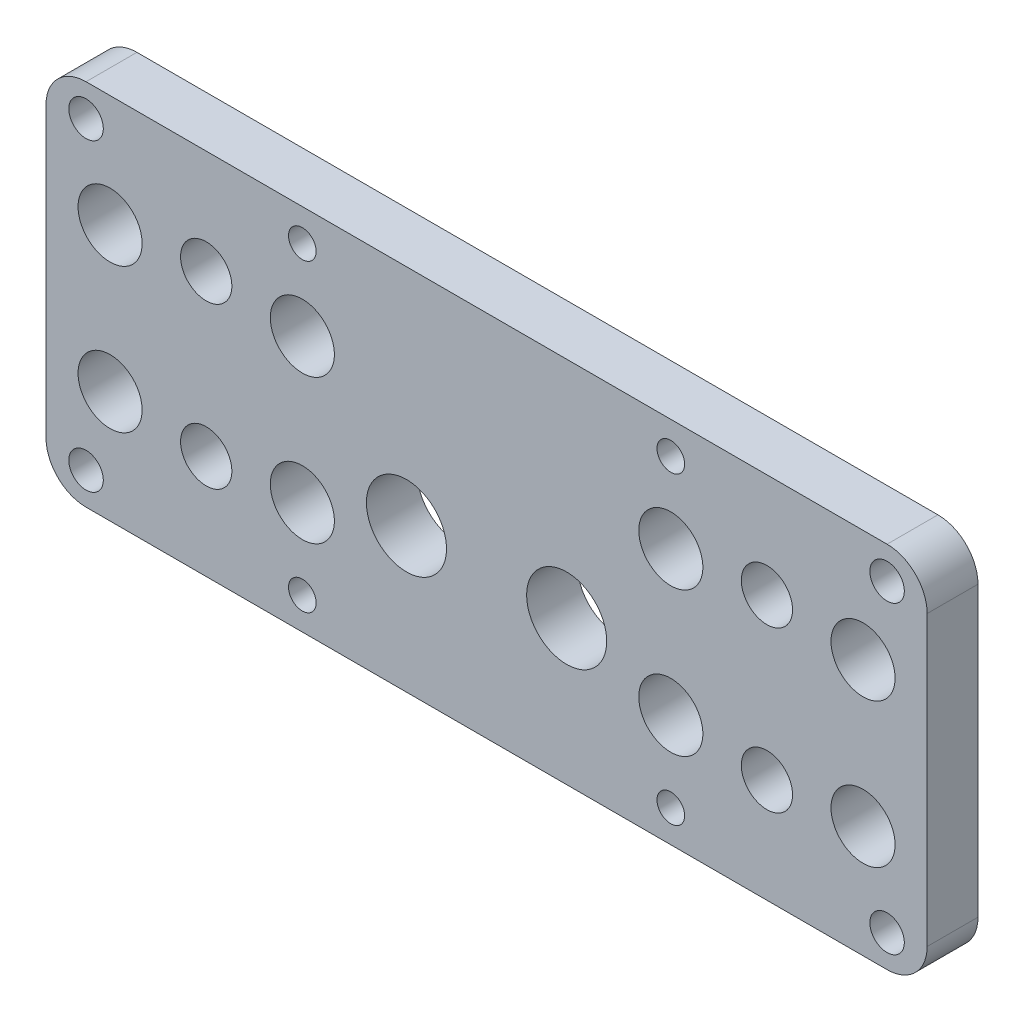
from build123d import *

# Parameters (mm, degrees)
SKETCH1_W             = 110
SKETCH1_H             = 46
BOSS_EXTRUDE1_DEPTH   = 6.35
M6_CLEARANCE_HOLE1_D  = 6.4
SKETCH5_R             = 5
CUT_EXTRUDE1_DEPTH    = 60.952668831
SKETCH7_R             = 4
CUT_EXTRUDE2_DEPTH    = 60.952668831
FILLET1_R             = 5
F_8_32_TAPPED_HOLE1_D = 3.4544
F_8_CLEARANCE_HOLE1_D = 4.3053


with BuildPart() as part:
    # Sketch1 → Boss-Extrude1 (new body)
    with BuildSketch(Plane.XY):
        Rectangle(SKETCH1_W, SKETCH1_H)
    extrude(amount=BOSS_EXTRUDE1_DEPTH)

    # M6 Clearance Hole1 (through all)
    with Locations(Plane(origin=(0, 0, 0), x_dir=(-1, 0, 0), z_dir=(0, 0, -1))):
        with Locations((-35, 10), (-35, -10), (35, -10), (35, 10)):
            Hole(M6_CLEARANCE_HOLE1_D / 2)

    # Sketch5 → Cut-Extrude1 (cut, through all)
    with BuildSketch(Plane(origin=(0, 0, 0), x_dir=(-1, 0, 0), z_dir=(0, 0, -1))):
        with Locations((-10, -5)):
            Circle(SKETCH5_R)
        with Locations((10, -5)):
            Circle(SKETCH5_R)
    extrude(amount=-CUT_EXTRUDE1_DEPTH, mode=Mode.SUBTRACT)

    # Sketch7 → Cut-Extrude2 (cut, through all)
    with BuildSketch(Plane(origin=(0, 0, 0), x_dir=(-1, 0, 0), z_dir=(0, 0, -1))):
        with Locations((-23, 9)):
            Circle(SKETCH7_R)
        with Locations((-23, -9)):
            Circle(SKETCH7_R)
        with Locations((23, -9)):
            Circle(SKETCH7_R)
        with Locations((23, 9)):
            Circle(SKETCH7_R)
        with Locations((-47, 9)):
            Circle(SKETCH7_R)
        with Locations((-47, -9)):
            Circle(SKETCH7_R)
        with Locations((47, 9)):
            Circle(SKETCH7_R)
        with Locations((47, -9)):
            Circle(SKETCH7_R)
    extrude(amount=-CUT_EXTRUDE2_DEPTH, mode=Mode.SUBTRACT)

    # Fillet1
    fillet1_edges = [part.edges().sort_by_distance(p)[0] for p in [
        (-55, 23, 3.175),
        (-55, -23, 3.175),
        (55, -23, 3.175),
        (55, 23, 3.175),
    ]]
    fillet(fillet1_edges, radius=FILLET1_R)

    # #8-32 Tapped Hole1 (through all)
    with Locations(Plane(origin=(0, 0, 0), x_dir=(-1, 0, 0), z_dir=(0, 0, -1))):
        with Locations((-23, 19), (23, 19), (23, -19), (-23, -19)):
            Hole(F_8_32_TAPPED_HOLE1_D / 2)

    # #8 Clearance Hole1 (through all)
    with Locations(Plane(origin=(0, 0, 0), x_dir=(-1, 0, 0), z_dir=(0, 0, -1))):
        with Locations((-50, 19), (-50, -19), (50, -19), (50, 19)):
            Hole(F_8_CLEARANCE_HOLE1_D / 2)


solid = part.part
